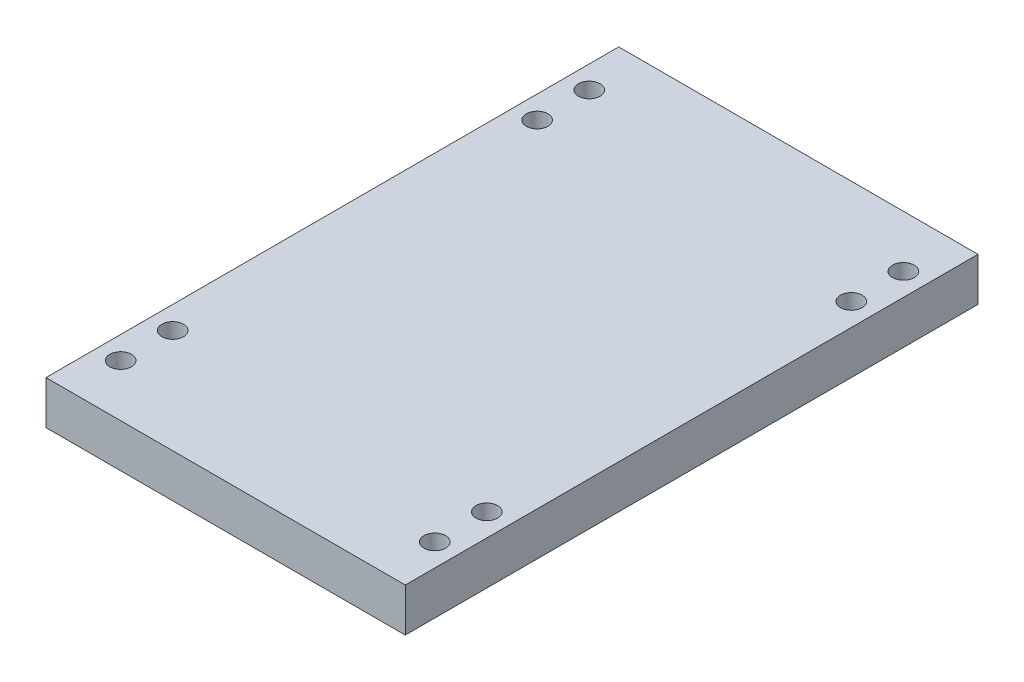
from build123d import *

# Parameters (mm, degrees)
SKETCH1_W           = 53.594
SKETCH1_H           = 76.2
BOSS_EXTRUDE1_DEPTH = 6.35
SKETCH2_R           = 1.5875
HOLE_CUTS_1_DEPTH   = 94.376010495
SKETCH6_W           = 53.594
SKETCH6_H           = 6.35
BOSS_EXTRUDE3_DEPTH = 7.62
HOLE_CUTS_2_REACH   = 95.376
SKETCH7_R           = 1.5875
CUT_EXTRUDE2_REACH  = 95.376
SKETCH3_W           = 0.508
SKETCH3_H           = 83.82


with BuildPart() as part:
    # Sketch1 → Boss-Extrude1 (new body)
    with BuildSketch(Plane(origin=(0, 0, 0), x_dir=(1, 0, 0), z_dir=(0, 1, 0))):
        with Locations((-26.797, 38.1)):
            Rectangle(SKETCH1_W, SKETCH1_H)
    extrude(amount=BOSS_EXTRUDE1_DEPTH)

    # Sketch2 → Hole Cuts 1 (cut, through all)
    with BuildSketch(Plane(origin=(0, 6.35, 0), x_dir=(1, 0, 0), z_dir=(0, 1, 0))):
        with Locations((-3.81, 7.62)):
            Circle(SKETCH2_R)
        with Locations((-3.81, 68.58)):
            Circle(SKETCH2_R)
    hole_cuts_1 = extrude(amount=-HOLE_CUTS_1_DEPTH, mode=Mode.SUBTRACT)

    # Sketch6 → Boss-Extrude3 (add)
    with BuildSketch(Plane.XY):
        with Locations((-26.797, 3.175)):
            Rectangle(SKETCH6_W, SKETCH6_H)
    extrude(amount=BOSS_EXTRUDE3_DEPTH)

    # Sketch7 → Hole Cuts 2 (cut, up to next)
    with BuildSketch(Plane(origin=(0, 6.35, 0), x_dir=(1, 0, 0), z_dir=(0, 1, 0)), mode=Mode.PRIVATE) as hole_cuts_2_sk1:
        with Locations((-3.81, 0)):
            Circle(SKETCH7_R)
    hole_cuts_2_tool1 = extrude(hole_cuts_2_sk1.sketch, amount=-HOLE_CUTS_2_REACH, mode=Mode.PRIVATE) & part.part
    # Sketch7 → Hole Cuts 2 (cut, up to next)
    with BuildSketch(Plane(origin=(0, 6.35, 0), x_dir=(1, 0, 0), z_dir=(0, 1, 0)), mode=Mode.PRIVATE) as hole_cuts_2_sk2:
        with Locations((-3.81, 60.96)):
            Circle(SKETCH7_R)
    hole_cuts_2_tool2 = extrude(hole_cuts_2_sk2.sketch, amount=-HOLE_CUTS_2_REACH, mode=Mode.PRIVATE) & part.part
    hole_cuts_2_1 = hole_cuts_2_tool1.solids().sort_by_distance((-3.81, 6.35, 0))[0]
    add(hole_cuts_2_1, mode=Mode.SUBTRACT)
    hole_cuts_2_2 = hole_cuts_2_tool2.solids().sort_by_distance((-3.81, 6.35, -60.96))[0]
    add(hole_cuts_2_2, mode=Mode.SUBTRACT)
    hole_cuts_2 = hole_cuts_2_1 + hole_cuts_2_2  # Hole Cuts 2 as one shape, for the pattern or mirror that repeats it

    # Sketch3 → Cut-Extrude2 (cut, up to next)
    with BuildSketch(Plane(origin=(0, 6.35, 0), x_dir=(1, 0, 0), z_dir=(0, 1, 0)), mode=Mode.PRIVATE) as cut_extrude2_sk1:
        with Locations((-0.254, 34.29)):
            Rectangle(SKETCH3_W, SKETCH3_H)
    cut_extrude2_tool1 = extrude(cut_extrude2_sk1.sketch, amount=-CUT_EXTRUDE2_REACH, mode=Mode.PRIVATE) & part.part
    cut_extrude2 = cut_extrude2_tool1.solids().sort_by_distance((-0.254, 6.35, -34.29))[0]
    add(cut_extrude2, mode=Mode.SUBTRACT)

    # Mirror1: Hole Cuts 1, Hole Cuts 2, Cut-Extrude2 across plane
    add(hole_cuts_1.mirror(Plane(origin=(-26.797, 0, 0), x_dir=(0, 0, 1), z_dir=(1, 0, 0))), mode=Mode.SUBTRACT)
    add(hole_cuts_2.mirror(Plane(origin=(-26.797, 0, 0), x_dir=(0, 0, 1), z_dir=(1, 0, 0))), mode=Mode.SUBTRACT)
    add(cut_extrude2.mirror(Plane(origin=(-26.797, 0, 0), x_dir=(0, 0, 1), z_dir=(1, 0, 0))), mode=Mode.SUBTRACT)


solid = part.part
